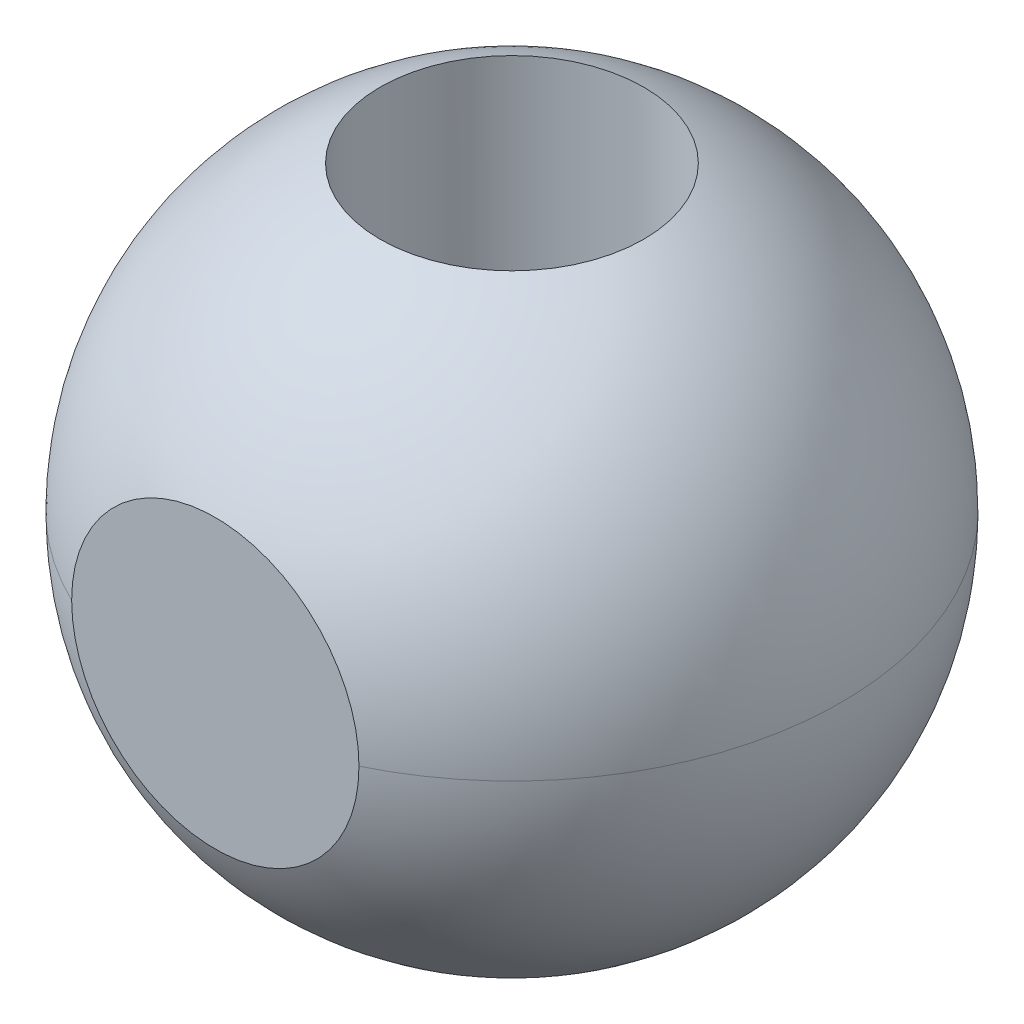
from build123d import *
from build123d.topology import SkipClean

# Parameters (mm, degrees)
SKETCH1_R               = 12.7
BOSS_EXTRUDE1_DEPTH     = 12.7
FILLET1_R               = 12.7
BOSS_EXTRUDE2_START     = 12.7
SKETCH2_R               = 12.7
BOSS_EXTRUDE2_DEPTH     = 12.7
FILLET2_R               = 12.7
CUT_EXTRUDE1_DEPTH      = 22.997045372
CUT_EXTRUDE1_DEPTH_BACK = 22.997045372
SKETCH3_R               = 5.08
CUT_EXTRUDE2_DEPTH      = 22.402439379
CUT_EXTRUDE2_DEPTH_BACK = 22.402439379
SKETCH5_W               = 27.579814606
SKETCH5_H               = 6.012661004


with BuildPart() as part:
    # Sketch1 → Boss-Extrude1 (new body)
    with BuildSketch(Plane(origin=(0, 0, 0), x_dir=(1, 0, 0), z_dir=(0, 1, 0))):
        with Locations(Location((0, 0, 0), (0, 0, 270))):
            Circle(SKETCH1_R)
    extrude(amount=BOSS_EXTRUDE1_DEPTH)

    # Fillet1
    fillet1_edges = [part.edges().sort_by_distance(p)[0] for p in [
        (0, 12.7, -12.7),
    ]]
    fillet(fillet1_edges, radius=FILLET1_R - 0.0001)  # a hair under: the kernel refuses the full size

    # Sketch2 → Boss-Extrude2 (add)
    with SkipClean():  # the faces are left unmerged after this step: merging them gives an invalid solid
        with BuildSketch(Plane.XZ.offset(BOSS_EXTRUDE2_START)):
            with Locations(Location((0, 0, 0), (0, 0, 270))):
                Circle(SKETCH2_R)
        extrude(amount=-BOSS_EXTRUDE2_DEPTH)

    # Fillet2
    fillet2_edges = [part.edges().sort_by_distance(p)[0] for p in [
        (0, -12.7, 12.7),
    ]]
    fillet(fillet2_edges, radius=FILLET2_R - 0.0001)  # a hair under: the kernel refuses the full size

    # Sketch3 → Cut-Extrude1 (cut, two sides: drawn at the far end of the back side and taken through both)
    with BuildSketch(Plane(origin=(0, 0, 0), x_dir=(1, 0, 0), z_dir=(0, 1, 0)).offset(-CUT_EXTRUDE1_DEPTH_BACK)):
        with Locations(Location((0, 0, 0), (0, 0, 90))):
            Circle(SKETCH3_R)
    extrude(amount=CUT_EXTRUDE1_DEPTH + CUT_EXTRUDE1_DEPTH_BACK, mode=Mode.SUBTRACT)

    # Sketch5 → Cut-Extrude2 (cut, two sides: drawn at the far end of the back side and taken through both)
    with BuildSketch(Plane(origin=(0, 0, 0), x_dir=(1, 0, 0), z_dir=(0, 1, 0)).offset(-CUT_EXTRUDE2_DEPTH_BACK)):
        with Locations((0.71890512, -14.436330502)):
            Rectangle(SKETCH5_W, SKETCH5_H)
    extrude(amount=CUT_EXTRUDE2_DEPTH + CUT_EXTRUDE2_DEPTH_BACK, mode=Mode.SUBTRACT)


solid = part.part
